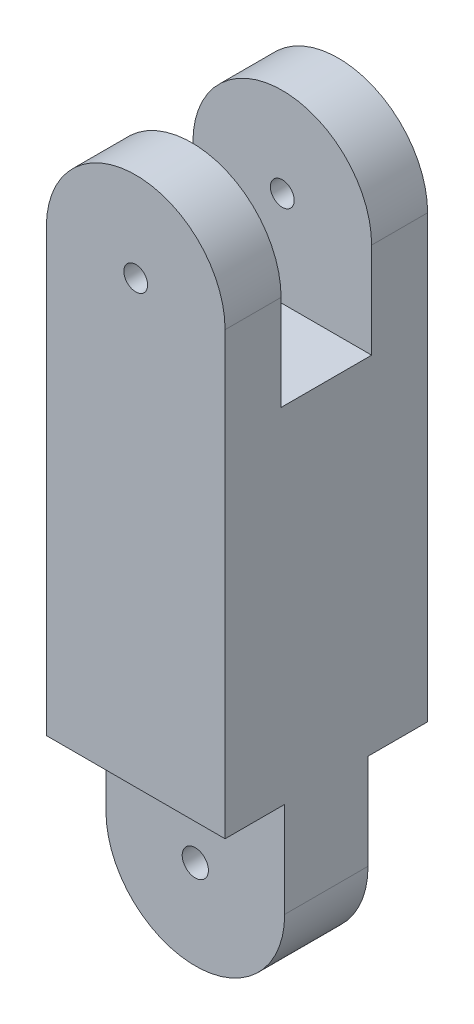
from build123d import *

# Parameters (mm, degrees)
LINK1_BODY_DEPTH        = 8.5
CUT_EXTRUDE1_DEPTH      = 56.258483512
CUT_EXTRUDE1_DEPTH_BACK = 56.258483512
SKETCH1_W               = 5.5
SKETCH1_H               = 15.998130079
CUT_EXTRUDE2_DEPTH      = 54.709868739
CUT_EXTRUDE2_DEPTH_BACK = 54.709868739
SKETCH2_W               = 7.6
SKETCH2_H               = 18
CUT_EXTRUDE3_DEPTH      = 54.709868739
CUT_EXTRUDE3_DEPTH_BACK = 54.709868739
SKETCH3_R               = 1.1
SKETCH3_R_2             = 1


with BuildPart() as part:
    # Link1_Outline → Link1_Body (new, symmetric)
    with BuildSketch(Plane.XY):
        with BuildLine():
            Line((-7.5, 0), (-7.5, 45))
            ThreePointArc((-7.5, 45), (0, 52.5), (7.5, 45))
            Line((7.5, 45), (7.5, 0))
            ThreePointArc((7.5, 0), (0, -7.5), (-7.5, 0))
        make_face()
    extrude(amount=LINK1_BODY_DEPTH, both=True)

    # Sketch1 → Cut-Extrude1 (cut, two sides: drawn at the far end of the back side and taken through both)
    with BuildSketch(Plane(origin=(7.5, 0, 0), x_dir=(0, 0, -1), z_dir=(1, 0, 0)).offset(-CUT_EXTRUDE1_DEPTH_BACK)):
        with Locations((6.25, -0.00093496)):
            Rectangle(SKETCH1_W, SKETCH1_H)
        with Locations((-6.25, -0.00093496)):
            Rectangle(SKETCH1_W, SKETCH1_H)
    extrude(amount=CUT_EXTRUDE1_DEPTH + CUT_EXTRUDE1_DEPTH_BACK, mode=Mode.SUBTRACT)

    # Sketch2 → Cut-Extrude2 (cut, two sides: drawn at the far end of the back side and taken through both)
    with BuildSketch(Plane(origin=(0, 0, 0), x_dir=(0, 0, -1), z_dir=(1, 0, 0)).offset(-CUT_EXTRUDE2_DEPTH_BACK)):
        with Locations((0, 46)):
            Rectangle(SKETCH2_W, SKETCH2_H)
    extrude(amount=CUT_EXTRUDE2_DEPTH + CUT_EXTRUDE2_DEPTH_BACK, mode=Mode.SUBTRACT)

    # Sketch3 → Cut-Extrude3 (cut, two sides: drawn at the far end of the back side and taken through both)
    with BuildSketch(Plane.XY.offset(-CUT_EXTRUDE3_DEPTH_BACK)):
        Circle(SKETCH3_R)
        with Locations((0, 45)):
            Circle(SKETCH3_R_2)
    extrude(amount=CUT_EXTRUDE3_DEPTH + CUT_EXTRUDE3_DEPTH_BACK, mode=Mode.SUBTRACT)


solid = part.part
